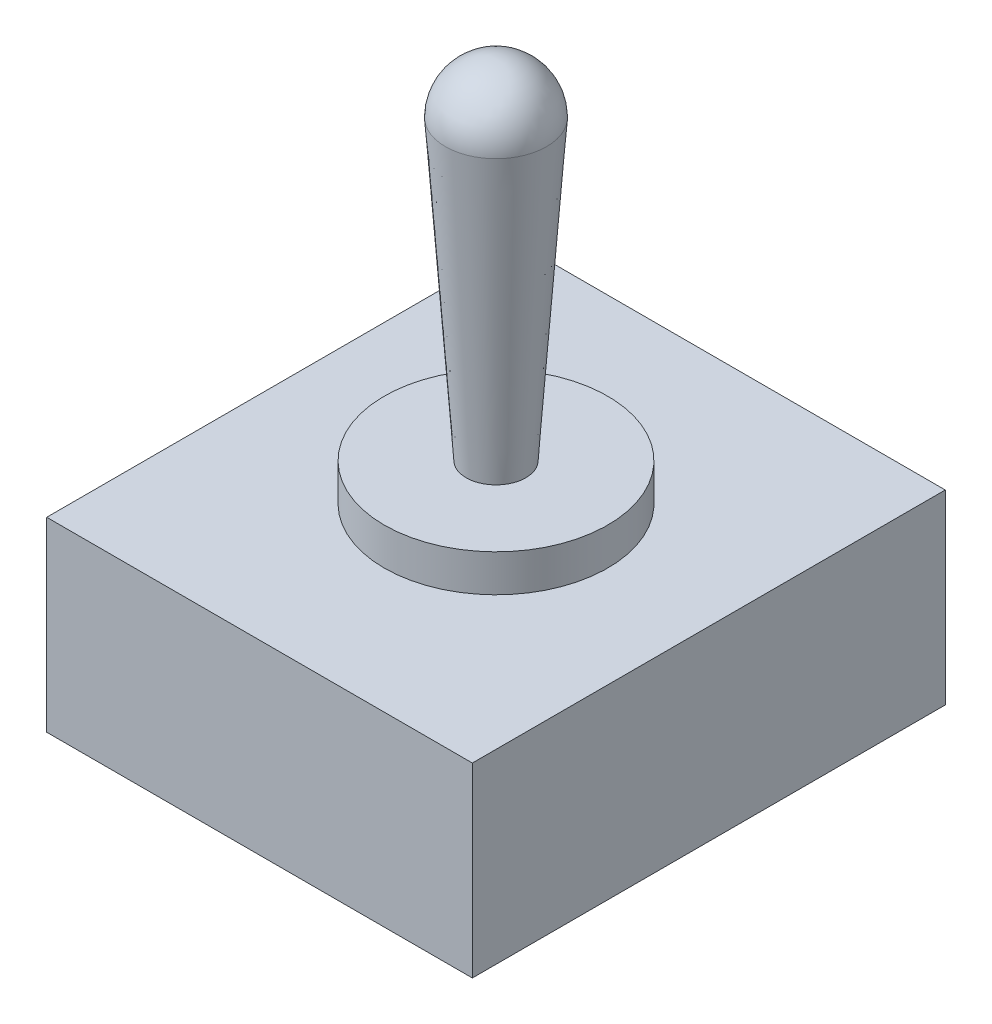
from build123d import *

# Parameters (mm, degrees)
SKETCH1_W           = 11.43
SKETCH1_H           = 12.7
BOSS_EXTRUDE1_DEPTH = 5
SKETCH2_R           = 3
BOSS_EXTRUDE4_DEPTH = 1


with BuildPart() as part:
    # Sketch1 → Boss-Extrude1 (new body)
    with BuildSketch(Plane(origin=(0, 0, 0), x_dir=(1, 0, 0), z_dir=(0, 1, 0))):
        with Locations((5.715, 6.35)):
            Rectangle(SKETCH1_W, SKETCH1_H)
    extrude(amount=BOSS_EXTRUDE1_DEPTH)

    # Sketch2 → Boss-Extrude4 (add)
    with BuildSketch(Plane(origin=(0, 5, 0), x_dir=(1, 0, 0), z_dir=(0, 1, 0))):
        with Locations((5.715, 6.35)):
            Circle(SKETCH2_R)
    extrude(amount=BOSS_EXTRUDE4_DEPTH)


with BuildPart() as body_2:
    # Sketch3 → Revolve3 (revolve)
    with BuildSketch(Plane.ZY.offset(-5.715)):
        with BuildLine():
            ThreePointArc((-7.15, 6), (-6.915685425, 6.565685425), (-6.35, 6.8))
            Line((-6.35, 6.8), (-6.35, 15.338564192))
            ThreePointArc((-6.35, 15.338564192), (-7.31028763, 14.940800032), (-7.70805179, 13.980512402))
            Line((-7.70805179, 13.980512402), (-7.15, 6))
        make_face()
    revolve(axis=Axis((5.715, 6, -6.35), (0, 1, 0)))


solid = Compound([part.part, body_2.part])
